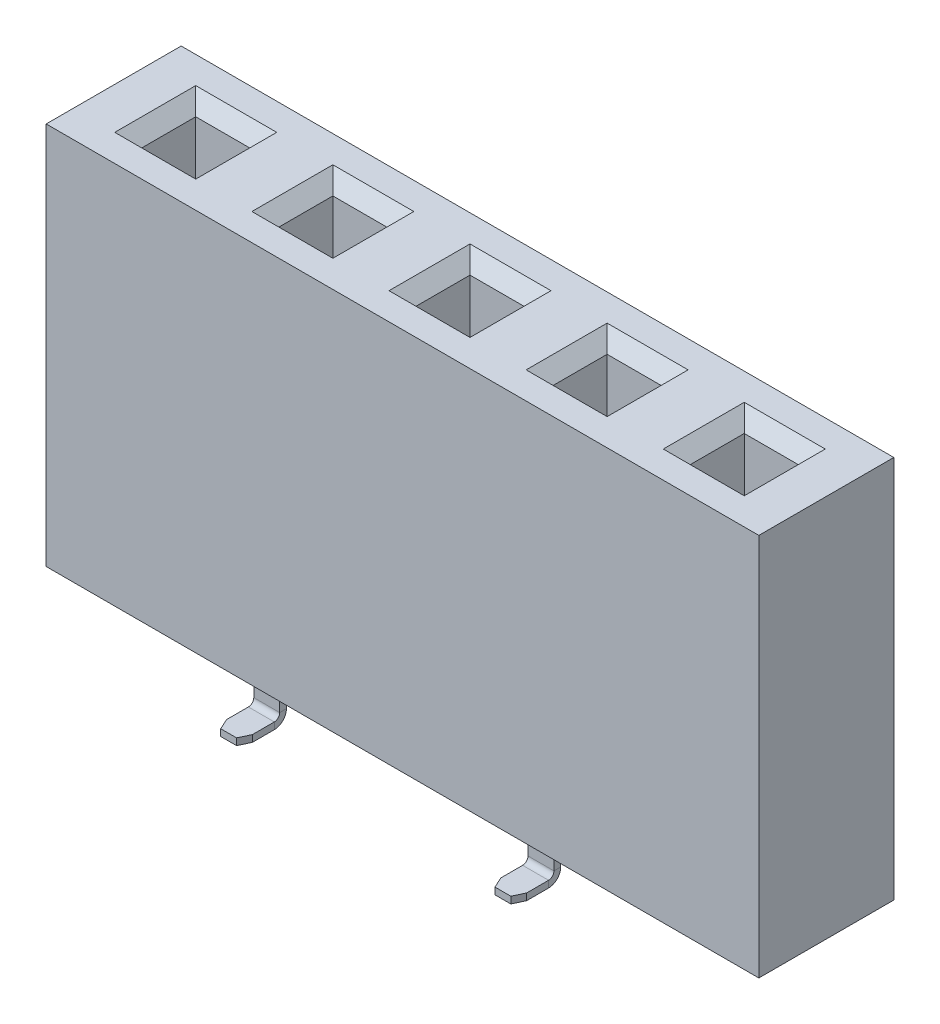
from build123d import *
from OCP.BRepFilletAPI import BRepFilletAPI_MakeChamfer

# Parameters (mm, degrees)
SKETCH1_W                  = 13.2
SKETCH1_H                  = 7.1
BOSS_EXTRUDE1_DEPTH        = 2.5
SKETCH2_W                  = 1
SKETCH2_H                  = 1
CUT_EXTRUDE1_DEPTH         = 2.5
CHAMFER1_SIZE              = 0.25
LPATTERN6_COUNT            = 5
LPATTERN6_PITCH            = 2.54
CHAMFER1_OF_LPATTERN6_SIZE = 0.25
BASE_FLANGE2_DEPTH         = 0.24
BASE_FLANGE2_DEPTH_BACK    = 0.24
BASE_FLANGE3_DEPTH         = 0.24
BASE_FLANGE3_DEPTH_BACK    = 0.24
CHAMFER3_SIZE              = 0.2
CHAMFER3_SIZE2             = 0.093261532
CHAMFER4_SIZE              = 0.2
CHAMFER4_SIZE2             = 0.093261532
LPATTERN4_COUNT            = 3
LPATTERN4_PITCH            = 5.08
LPATTERN3_COUNT            = 2
LPATTERN3_PITCH            = 5.08


# Sheet-metal steps are written as plain solids
with BuildPart() as part:
    # Sketch1 → Boss-Extrude1 (new body)
    with BuildSketch(Plane.XY):
        Rectangle(SKETCH1_W, SKETCH1_H)
    extrude(amount=BOSS_EXTRUDE1_DEPTH)

    # Sketch2 → Cut-Extrude1 (cut)
    with BuildSketch(Plane(origin=(0, 3.55, 0), x_dir=(1, 0, 0), z_dir=(0, 1, 0))):
        with Locations((-5.08, -1.25)):
            Rectangle(SKETCH2_W, SKETCH2_H)
    cut_extrude1 = extrude(amount=-CUT_EXTRUDE1_DEPTH, mode=Mode.SUBTRACT)

    # Chamfer1
    chamfer1_edges = [part.edges().sort_by_distance(p)[0] for p in [
        (-4.58, 3.55, 1.25),
        (-5.08, 3.55, 0.75),
        (-5.58, 3.55, 1.25),
        (-5.08, 3.55, 1.75),
    ]]
    chamfer(chamfer1_edges, length=CHAMFER1_SIZE)

    # LPattern6: Cut-Extrude1 ×5
    with Locations(*[(i * LPATTERN6_PITCH, 0, 0) for i in range(1, LPATTERN6_COUNT)]):
        add(cut_extrude1, mode=Mode.SUBTRACT)

    # Chamfer1 of LPattern6
    chamfer1_of_lpattern6_edges = [part.edges().sort_by_distance(p)[0] for p in [
        (-2.04, 3.55, 1.25),
        (-2.54, 3.55, 0.75),
        (-3.04, 3.55, 1.25),
        (-2.54, 3.55, 1.75),
        (0.5, 3.55, 1.25),
        (0, 3.55, 0.75),
        (-0.5, 3.55, 1.25),
        (0, 3.55, 1.75),
        (3.04, 3.55, 1.25),
        (2.54, 3.55, 0.75),
        (2.04, 3.55, 1.25),
        (2.54, 3.55, 1.75),
        (5.58, 3.55, 1.25),
        (5.08, 3.55, 0.75),
        (4.58, 3.55, 1.25),
        (5.08, 3.55, 1.75),
    ]]
    chamfer(chamfer1_of_lpattern6_edges, length=CHAMFER1_OF_LPATTERN6_SIZE)


with BuildPart() as body_2:
    # Sketch5 → Base-Flange2 (new, two sides: drawn at the far end of the back side and taken through both)
    with BuildSketch(Plane.ZY.offset(5.08).offset(-BASE_FLANGE2_DEPTH_BACK)):
        with BuildLine():
            Line((0.15, -3.55), (0.15, -3.755))
            ThreePointArc((0.15, -3.755), (0.084099026, -3.914099026), (-0.075, -3.98))
            Line((-0.075, -3.98), (-0.68, -3.98))
            Line((-0.68, -3.98), (-0.68, -3.855))
            Line((-0.68, -3.855), (-0.075, -3.855))
            ThreePointArc((-0.075, -3.855), (-0.004289322, -3.825710678), (0.025, -3.755))
            Line((0.025, -3.755), (0.025, -3.55))
            Line((0.025, -3.55), (0.15, -3.55))
        make_face()
    extrude(amount=BASE_FLANGE2_DEPTH + BASE_FLANGE2_DEPTH_BACK)

    # Chamfer4: one chamfer whose edges measure the first distance from different faces: ONE call of the kernel's chamfer builder (chamfer() names one face for all edges)
    chamfer4_edges_1 = [body_2.edges().sort_by_distance(p)[0] for p in [
        (-4.84, -3.9175, -0.68),
    ]]
    chamfer4_side_1 = [body_2.faces().sort_by_distance(p)[0] for p in [
        (-4.84, -3.6525, 0.034347727),
    ]]
    chamfer4_edges_2 = [body_2.edges().sort_by_distance(p)[0] for p in [
        (-5.32, -3.9175, -0.68),
    ]]
    chamfer4_side_2 = [body_2.faces().sort_by_distance(p)[0] for p in [
        (-5.32, -3.6525, 0.034347727),
    ]]
    chamfer4 = BRepFilletAPI_MakeChamfer(body_2.part.solid().wrapped)
    for e in chamfer4_edges_1:
        chamfer4.Add(CHAMFER4_SIZE, CHAMFER4_SIZE2, e.wrapped, chamfer4_side_1[0].wrapped)  # the first distance lies on this face
    for e in chamfer4_edges_2:
        chamfer4.Add(CHAMFER4_SIZE, CHAMFER4_SIZE2, e.wrapped, chamfer4_side_2[0].wrapped)  # the first distance lies on this face
    add(Compound.cast(chamfer4.Shape()), mode=Mode.REPLACE)


with BuildPart() as body_3:
    # Sketch22 → Base-Flange3 (new, two sides: drawn at the far end of the back side and taken through both)
    with BuildSketch(Plane.ZY.offset(2.54).offset(-BASE_FLANGE3_DEPTH_BACK)):
        with BuildLine():
            Line((2.35, -3.55), (2.35, -3.755))
            ThreePointArc((2.35, -3.755), (2.415900974, -3.914099026), (2.575, -3.98))
            Line((2.575, -3.98), (3.18, -3.98))
            Line((3.18, -3.98), (3.18, -3.855))
            Line((3.18, -3.855), (2.575, -3.855))
            ThreePointArc((2.575, -3.855), (2.504289322, -3.825710678), (2.475, -3.755))
            Line((2.475, -3.755), (2.475, -3.55))
            Line((2.475, -3.55), (2.35, -3.55))
        make_face()
    extrude(amount=BASE_FLANGE3_DEPTH + BASE_FLANGE3_DEPTH_BACK)

    # Chamfer3: one chamfer whose edges measure the first distance from different faces: ONE call of the kernel's chamfer builder (chamfer() names one face for all edges)
    chamfer3_edges_1 = [body_3.edges().sort_by_distance(p)[0] for p in [
        (-2.3, -3.9175, 3.18),
    ]]
    chamfer3_side_1 = [body_3.faces().sort_by_distance(p)[0] for p in [
        (-2.3, -3.6525, 2.465652273),
    ]]
    chamfer3_edges_2 = [body_3.edges().sort_by_distance(p)[0] for p in [
        (-2.78, -3.9175, 3.18),
    ]]
    chamfer3_side_2 = [body_3.faces().sort_by_distance(p)[0] for p in [
        (-2.78, -3.6525, 2.465652273),
    ]]
    chamfer3 = BRepFilletAPI_MakeChamfer(body_3.part.solid().wrapped)
    for e in chamfer3_edges_1:
        chamfer3.Add(CHAMFER3_SIZE, CHAMFER3_SIZE2, e.wrapped, chamfer3_side_1[0].wrapped)  # the first distance lies on this face
    for e in chamfer3_edges_2:
        chamfer3.Add(CHAMFER3_SIZE, CHAMFER3_SIZE2, e.wrapped, chamfer3_side_2[0].wrapped)  # the first distance lies on this face
    add(Compound.cast(chamfer3.Shape()), mode=Mode.REPLACE)


with BuildPart() as lpattern4_1:
    # LPattern4: pattern copy
    add(body_2.part.moved(Location(Vector(1, 0, 0) * (1 * LPATTERN4_PITCH))))


with BuildPart() as lpattern4_2:
    # LPattern4: pattern copy
    add(body_2.part.moved(Location(Vector(1, 0, 0) * (2 * LPATTERN4_PITCH))))


with BuildPart() as lpattern3_1:
    # LPattern3: pattern copy
    add(body_3.part.moved(Location(Vector(1, 0, 0) * (1 * LPATTERN3_PITCH))))


solid = Compound([part.part, body_2.part, body_3.part, lpattern4_1.part, lpattern4_2.part, lpattern3_1.part])
